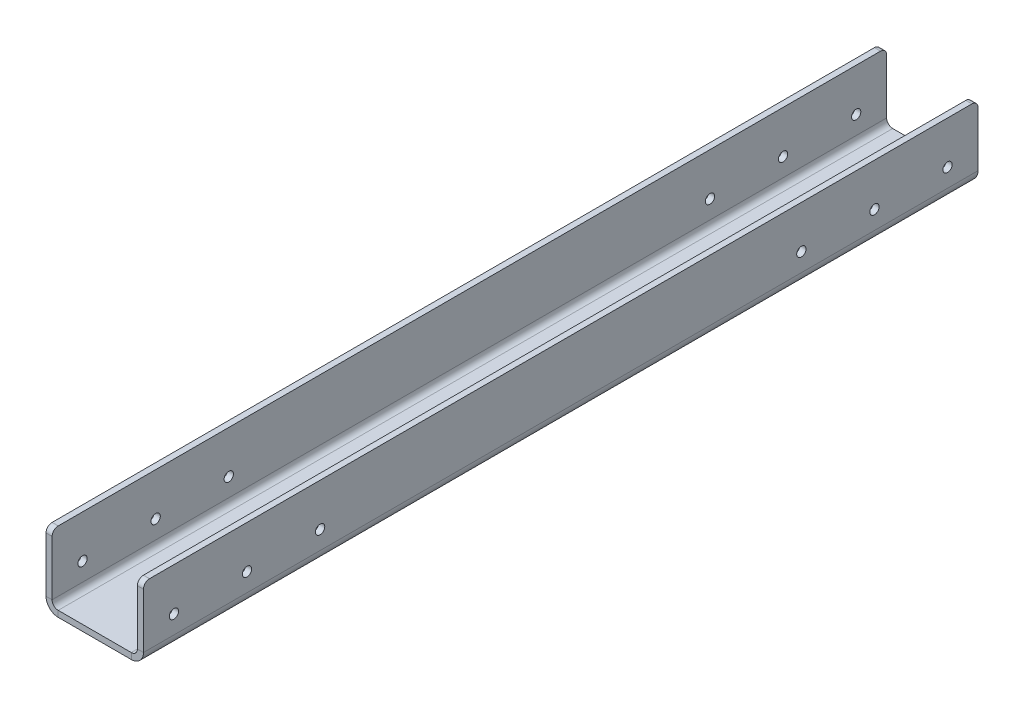
from build123d import *

# Parameters (mm, degrees)
BASE_FLANGE1_DEPTH = 434.975
SKETCH8_R          = 4.3688
SKETCH8_R_2        = 3.3782
CUT_EXTRUDE2_DEPTH = 440.585601021
SKETCH9_R          = 2.4257
CUT_EXTRUDE3_DEPTH = 440.585601021
FILLET1_R          = 3.175


# Sheet-metal steps are written as plain solids
with BuildPart() as part:
    # Sketch1 → Base-Flange1 (new body)
    with BuildSketch(Plane.XY):
        with BuildLine():
            Line((50.8, 38.1), (50.8, 6.35))
            ThreePointArc((50.8, 6.35), (48.940128061, 1.859871939), (44.45, 0))
            Line((44.45, 0), (6.35, 0))
            ThreePointArc((6.35, 0), (1.859871939, 1.859871939), (0, 6.35))
            Line((0, 6.35), (0, 38.1))
            Line((0, 38.1), (3.175, 38.1))
            Line((3.175, 38.1), (3.175, 6.35))
            ThreePointArc((3.175, 6.35), (4.10493597, 4.10493597), (6.35, 3.175))
            Line((6.35, 3.175), (44.45, 3.175))
            ThreePointArc((44.45, 3.175), (46.69506403, 4.10493597), (47.625, 6.35))
            Line((47.625, 6.35), (47.625, 38.1))
            Line((47.625, 38.1), (50.8, 38.1))
        make_face()
    extrude(amount=BASE_FLANGE1_DEPTH)

    # Sketch8 → Cut-Extrude2 (cut, through all)
    with BuildSketch(Plane.XZ):
        with Locations(Location((25.4, 100.0125, 0), (0, 0, 270))):
            Circle(SKETCH8_R)
        with Locations(Location((25.4, 334.9625, 0), (0, 0, 270))):
            Circle(SKETCH8_R)
        with Locations(Location((25.4, 217.4875, 0), (0, 0, 270))):
            Circle(SKETCH8_R_2)
        with Locations(Location((25.4, 74.6125, 0), (0, 0, 270))):
            Circle(SKETCH8_R_2)
        with Locations(Location((25.4, 360.3625, 0), (0, 0, 270))):
            Circle(SKETCH8_R_2)
    extrude(amount=-CUT_EXTRUDE2_DEPTH, mode=Mode.SUBTRACT)

    # Sketch9 → Cut-Extrude3 (cut, through all)
    with BuildSketch(Plane(origin=(50.8, 0, 0), x_dir=(0, 0, -1), z_dir=(1, 0, 0))):
        with Locations((-419.1, 15.875)):
            Circle(SKETCH9_R)
        with Locations((-381, 15.875)):
            Circle(SKETCH9_R)
        with Locations((-342.9, 15.875)):
            Circle(SKETCH9_R)
        with Locations((-92.075, 15.875)):
            Circle(SKETCH9_R)
        with Locations((-53.975, 15.875)):
            Circle(SKETCH9_R)
        with Locations((-15.875, 15.875)):
            Circle(SKETCH9_R)
    extrude(amount=-CUT_EXTRUDE3_DEPTH, mode=Mode.SUBTRACT)

    # Fillet1
    fillet1_edges = [part.edges().sort_by_distance(p)[0] for p in [
        (1.5875, 38.1, 0),
        (49.2125, 38.1, 0),
        (1.5875, 38.1, 434.975),
        (49.2125, 38.1, 434.975),
    ]]
    fillet(fillet1_edges, radius=FILLET1_R)


solid = part.part
